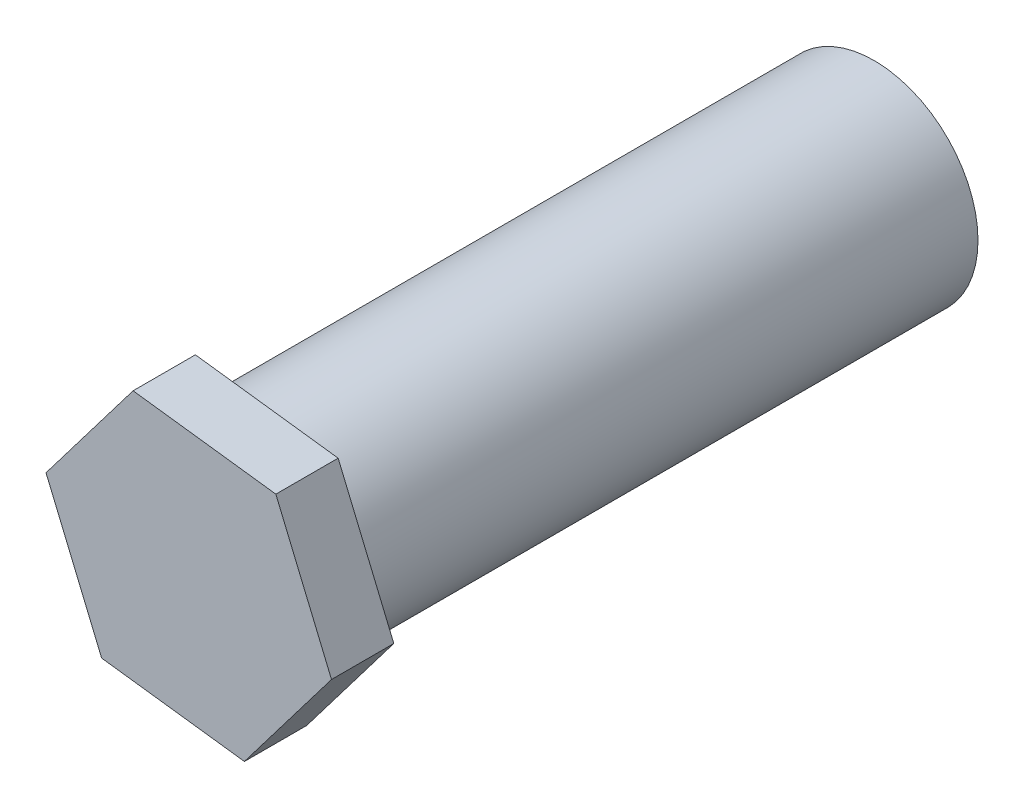
from build123d import *

# Parameters (mm, degrees)
SKETCH_1_R      = 2.5
EXTRUDE_1_DEPTH = 15
EXTRUDE_2_DEPTH = 1.5


with BuildPart() as part:
    # 스케치1 → 보스-돌출1 (new body)
    with BuildSketch(Plane.XY):
        Circle(SKETCH_1_R)
    extrude(amount=EXTRUDE_1_DEPTH)

    # 스케치2 → 보스-돌출2 (add)
    with BuildSketch(Plane(origin=(0, 0, 15), x_dir=(-1, 0, 0), z_dir=(0, 0, -1))):
        Polygon((2.096615278, -2.757572189), (3.436435207, 0.436935999), (1.339819929, 3.194508187), (-2.096615278, 2.757572189), (-3.436435207, -0.436935999), (-1.339819929, -3.194508187), align=None)
    extrude(amount=-EXTRUDE_2_DEPTH)


solid = part.part
